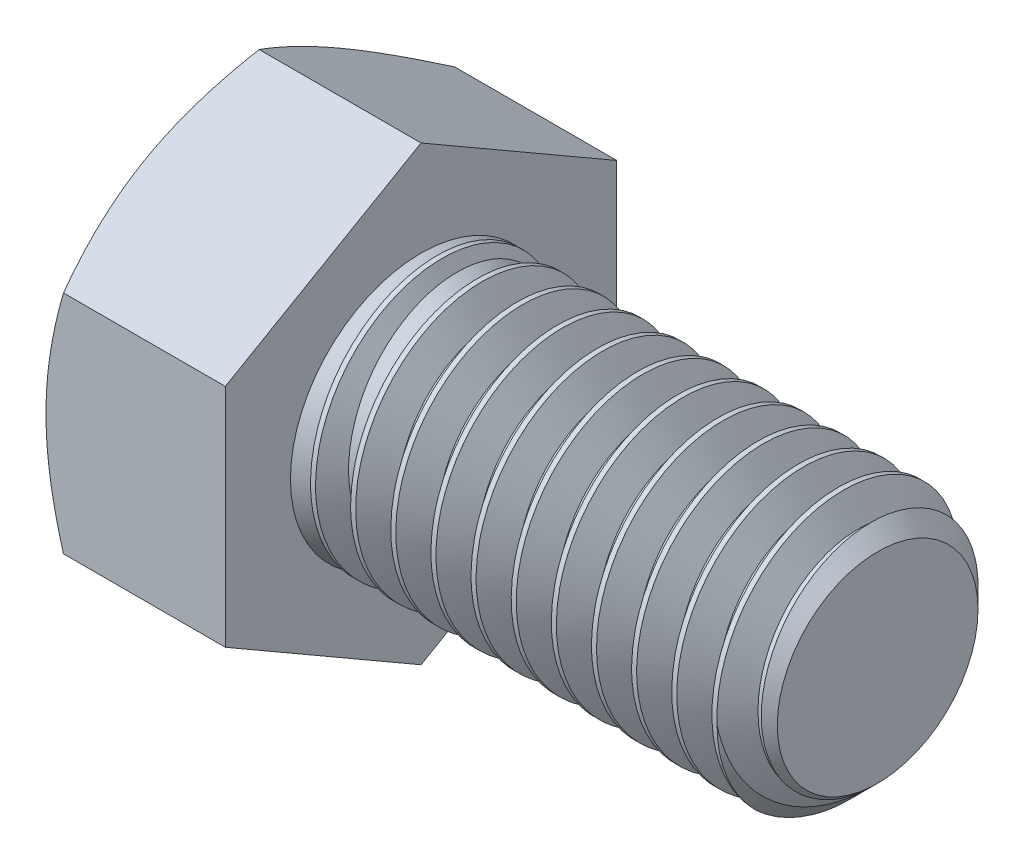
from build123d import *

# Parameters (mm, degrees)
SKETCH5_R           = 6.35
BOSS_EXTRUDE3_DEPTH = 22.225
CHAMFER1_SIZE       = 1.465384615
BOSS_EXTRUDE4_DEPTH = 8.73125
SKETCH8_OUTSIDE_W   = 151.5
SKETCH8_OUTSIDE_H   = 154.448
SKETCH8_OUTSIDE_R   = 9.525
CUT_EXTRUDE3_DEPTH  = 35.205007514
CUT_EXTRUDE3_DRAFT  = -60
CUT_EXTRUDE4_DEPTH  = 0.254
CIRPATTERN1_COUNT   = 6
CUT_SWEEP1_PITCH    = 1.953846154


with BuildPart() as part:
    # Sketch5 → Boss-Extrude3 (new body)
    with BuildSketch(Plane(origin=(15.478125, 0, 0), x_dir=(0, 0, -1), z_dir=(1, 0, 0))):
        Circle(SKETCH5_R)
    extrude(amount=-BOSS_EXTRUDE3_DEPTH)

    # Chamfer1
    chamfer1_edges = [part.edges().sort_by_distance(p)[0] for p in [
        (15.478125, 0, 6.35),
    ]]
    chamfer(chamfer1_edges, length=CHAMFER1_SIZE)

    # Cut-Sweep1: the profile of Sketch10 profile screwed along a right-hand helix of 12.375 turns, 10 arcs to a turn; built about Z, then put on its axis
    cut_sweep1_z = Axis((0, 0, 0), (0, 0, 1))
    cut_sweep1_corners = [(6.3503, 0, 0.000173205), (5.080939697, 0, -0.732692308), (5.080939697, 0, -0.976923077), (6.3503, 0, -1.70978859)]
    with BuildLine(mode=Mode.PRIVATE) as cut_sweep1_profile:
        Line(cut_sweep1_corners[0], cut_sweep1_corners[1])
        Line(cut_sweep1_corners[1], cut_sweep1_corners[2])
        Line(cut_sweep1_corners[2], cut_sweep1_corners[3])
        Line(cut_sweep1_corners[3], cut_sweep1_corners[0])
    cut_sweep1_cap = Face(cut_sweep1_profile.wire())
    cut_sweep1_turn_angles = [0, 18, 36, 54, 72, 90, 108, 126, 144, 162, 180, 198, 216, 234, 252, 270, 288, 306, 324, 342, 360]
    cut_sweep1_turn_weights = [1, 0.9510565162951535, 1, 0.9510565162951535, 1, 0.9510565162951535, 1, 0.9510565162951535, 1, 0.9510565162951535, 1, 0.9510565162951535, 1, 0.9510565162951535, 1, 0.9510565162951535, 1, 0.9510565162951535, 1, 0.9510565162951535, 1]
    cut_sweep1_turn_rails = [Edge.make_bspline([Vector(p[0], p[1], 0).rotate(cut_sweep1_z, cut_sweep1_turn_angles[k]) / cut_sweep1_turn_weights[k] + Vector(0, 0, p[2] + CUT_SWEEP1_PITCH * cut_sweep1_turn_angles[k] / 360) for k in range(21)], [0, 0, 0, 1, 1, 2, 2, 3, 3, 4, 4, 5, 5, 6, 6, 7, 7, 8, 8, 9, 9, 10, 10, 10], 2, cut_sweep1_turn_weights) for p in cut_sweep1_corners]
    cut_sweep1_turn_sides = [Face.make_surface_from_curves(cut_sweep1_turn_rails[p[0]], cut_sweep1_turn_rails[p[1]]) for p in [(0, 1), (1, 2), (2, 3), (3, 0)]]
    cut_sweep1_last_angles = [4320, 4338, 4356, 4374, 4392, 4410, 4428, 4441.5, 4455]
    cut_sweep1_last_weights = [1, 0.9510565162951535, 1, 0.9510565162951535, 1, 0.9510565162951535, 1, 0.9723699203976784, 1]
    cut_sweep1_last_rails = [Edge.make_bspline([Vector(p[0], p[1], 0).rotate(cut_sweep1_z, cut_sweep1_last_angles[k]) / cut_sweep1_last_weights[k] + Vector(0, 0, p[2] + CUT_SWEEP1_PITCH * cut_sweep1_last_angles[k] / 360) for k in range(9)], [0, 0, 0, 1, 1, 2, 2, 3, 3, 4, 4, 4], 2, cut_sweep1_last_weights) for p in cut_sweep1_corners]
    cut_sweep1_last_sides = [Face.make_surface_from_curves(cut_sweep1_last_rails[p[0]], cut_sweep1_last_rails[p[1]]) for p in [(0, 1), (1, 2), (2, 3), (3, 0)]]
    cut_sweep1 = Plane(origin=(15.478125, 0, 0), x_dir=(0, 1, 0), z_dir=(-1, 0, 0)) * Solid(Shell([*[p.moved(Location((0, 0, CUT_SWEEP1_PITCH * i))) for i in range(12) for p in cut_sweep1_turn_sides], *cut_sweep1_last_sides, cut_sweep1_cap, cut_sweep1_cap.rotate(cut_sweep1_z, 4455).moved(Location((0, 0, CUT_SWEEP1_PITCH * 4455 / 360)))]))
    add(cut_sweep1, mode=Mode.SUBTRACT)



with BuildPart() as body_2:
    # Sketch6 → Boss-Extrude4 (new body)
    with BuildSketch(Plane.ZY.offset(6.746875)):
        Polygon((9.525, 5.499261314), (0, 10.998522628), (-9.525, 5.499261314), (-9.525, -5.499261314), (0, -10.998522628), (9.525, -5.499261314), align=None)
    extrude(amount=BOSS_EXTRUDE4_DEPTH)


with BuildPart() as cut_extrude3_tool:
    # Sketch8 outside → Cut-Extrude3 (with draft: the straight prism first)
    with BuildSketch(Plane.ZY.offset(15.478125)):
        Rectangle(SKETCH8_OUTSIDE_W, SKETCH8_OUTSIDE_H)
        Circle(SKETCH8_OUTSIDE_R, mode=Mode.SUBTRACT)
    extrude(amount=-CUT_EXTRUDE3_DEPTH)
    # Cut-Extrude3: the draft: its side faces are tilted about the plane it starts from
    cut_extrude3_sides = [cut_extrude3_tool.faces().sort_by_distance(p)[0] for p in [
        (2.124378757, -77.224, 0),
        (2.124378757, 0, 75.75),
        (2.124378757, 77.224, 0),
        (2.124378757, 0, -75.75),
        (2.124378757, 0, -9.525),
    ]]
    draft(cut_extrude3_sides, Plane.ZY.offset(15.478125), CUT_EXTRUDE3_DRAFT)


with BuildPart() as body_2_1:
    add(body_2.part)

    # Cut-Extrude3: cut by cut_extrude3_tool
    add(cut_extrude3_tool.part, mode=Mode.SUBTRACT)

    # Sketch12 → Cut-Extrude4 (cut)
    with BuildSketch(Plane.ZY.offset(15.478125)):
        with BuildLine():
            Line((0.28575, 7.33425), (0.28575, 4.09575))
            ThreePointArc((0.28575, 4.09575), (0, 3.81), (-0.28575, 4.09575))
            Line((-0.28575, 4.09575), (-0.28575, 7.33425))
            ThreePointArc((-0.28575, 7.33425), (0, 7.62), (0.28575, 7.33425))
        make_face()
    cut_extrude4 = extrude(amount=-CUT_EXTRUDE4_DEPTH, mode=Mode.SUBTRACT)

    # CirPattern1: Cut-Extrude4 ×6 about axis
    cirpattern1_axis = Axis((0, 0, 0), (1, 0, 0))
    for i in range(1, CIRPATTERN1_COUNT):
        add(cut_extrude4.rotate(cirpattern1_axis, i * 360 / CIRPATTERN1_COUNT), mode=Mode.SUBTRACT)


with BuildPart() as part_1:
    add(part.part)

    add(body_2_1.part)  # Revolve7 merges body 2
    # Sketch13 → Revolve7 (revolve)
    with BuildSketch(Plane.XY, mode=Mode.PRIVATE) as revolve7_sk:
        Polygon((-7.000875, 0), (4.26242618, 0), (-6.746875, 6.356223), (-7.000875, 6.356223), align=None)
    revolve(revolve7_sk.sketch.rotate(Axis((-7.000875, 0, 0), (1, 0, 0)), 90), axis=Axis((-7.000875, 0, 0), (1, 0, 0)))


solid = part_1.part
